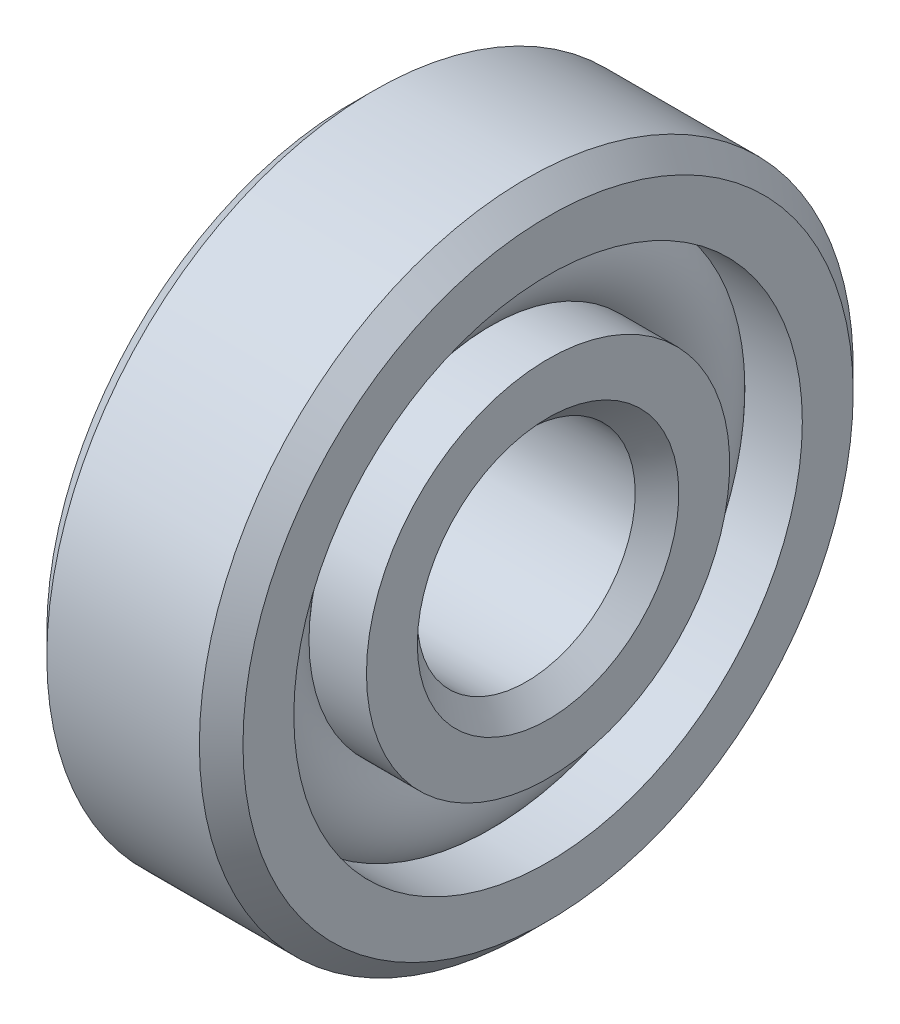
from build123d import *

# Parameters (mm, degrees)
SKETCH_1_5_R   = 2.5
CHAMFER_1_SIZE = 1
CHAMFER_3_SIZE = 1


with BuildPart() as part:
    # Эскиз1 → Повернуть1 (revolve)
    with BuildSketch(Plane.XY, mode=Mode.PRIVATE) as revolve_1_sk:
        with BuildLine():
            Line((0, 8.333333333), (0, 5))
            Line((0, 5), (9, 5))
            Line((9, 5), (9, 8.333333333))
            Line((9, 8.333333333), (6.363389981, 8.333333333))
            ThreePointArc((6.363389981, 8.333333333), (4.5, 7.5), (2.636610019, 8.333333333))
            Line((2.636610019, 8.333333333), (0, 8.333333333))
        make_face()
    revolve(revolve_1_sk.sketch.rotate(Axis((0, 0, 0), (1, 0, 0)), 90), axis=Axis((0, 0, 0), (1, 0, 0)))

    # Фаска1
    chamfer_1_edges = [part.edges().sort_by_distance(p)[0] for p in [
        (9, 0, -5),
        (0, 0, -5),
    ]]
    chamfer(chamfer_1_edges, length=CHAMFER_1_SIZE)


with BuildPart() as body_2:
    # Эскиз1<4> → Повернуть2 (revolve)
    with BuildSketch(Plane.XY, mode=Mode.PRIVATE) as revolve_2_sk:
        with BuildLine():
            Line((0, 15), (0, 11.666666667))
            Line((0, 11.666666667), (2.636610019, 11.666666667))
            ThreePointArc((2.636610019, 11.666666667), (4.5, 12.5), (6.363389981, 11.666666667))
            Line((6.363389981, 11.666666667), (9, 11.666666667))
            Line((9, 11.666666667), (9, 15))
            Line((9, 15), (0, 15))
        make_face()
    revolve(revolve_2_sk.sketch.rotate(Axis((0, 0, 0), (1, 0, 0)), 90), axis=Axis((0, 0, 0), (1, 0, 0)))

    # Фаска3
    chamfer_3_edges = [body_2.edges().sort_by_distance(p)[0] for p in [
        (0, 0, -15),
        (9, 0, -15),
    ]]
    chamfer(chamfer_3_edges, length=CHAMFER_3_SIZE)


with BuildPart() as body_3:
    # Эскиз1<5> → Повернуть3 (revolve)
    with BuildSketch(Plane.XY, mode=Mode.PRIVATE) as revolve_3_sk:
        with Locations((4.5, 10)):
            Circle(SKETCH_1_5_R)
    revolve(revolve_3_sk.sketch.rotate(Axis((0, 0, 0), (1, 0, 0)), 270), axis=Axis((0, 0, 0), (1, 0, 0)))


solid = Compound([part.part, body_2.part, body_3.part])
